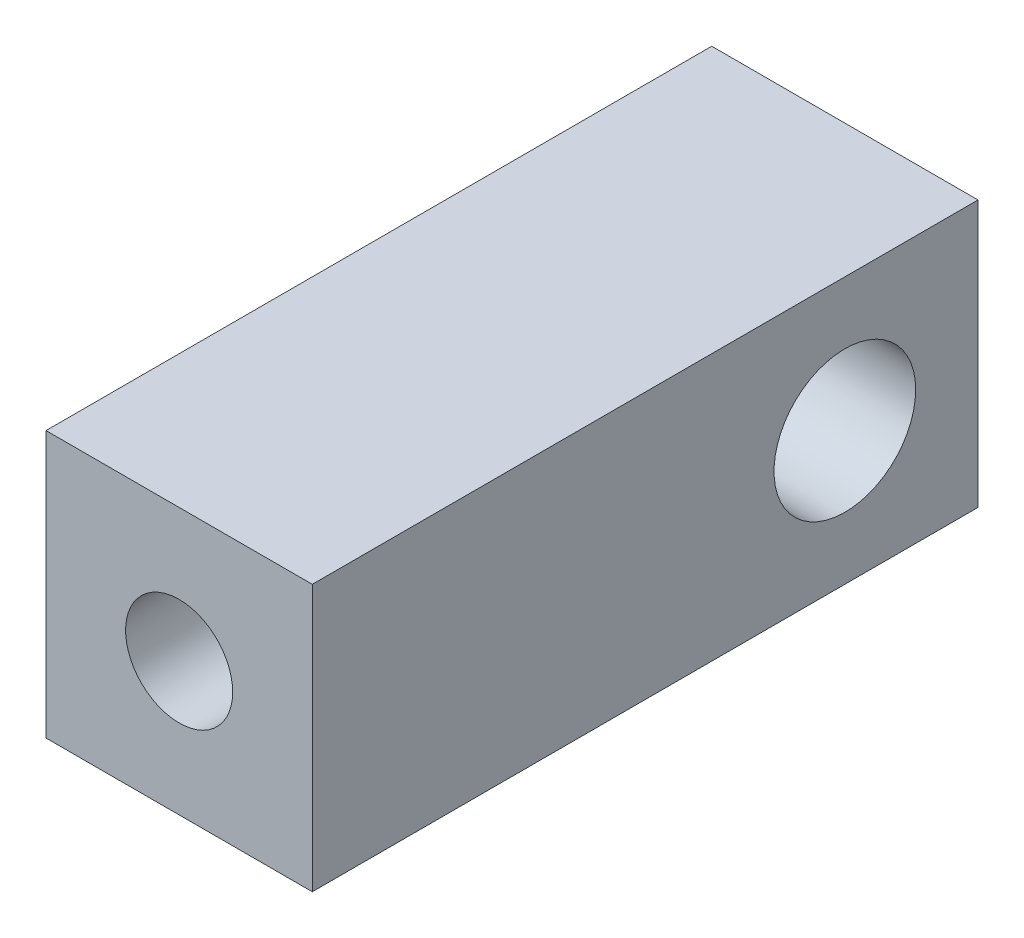
from build123d import *

# Parameters (mm, degrees)
SKETCH1_W                   = 31.75
SKETCH1_H                   = 12.7
BOSS_EXTRUDE1_DEPTH         = 12.7
F_1_4_20_TAPPED_HOLE1_D     = 5.1054
F_1_4_20_TAPPED_HOLE1_DEPTH = 16.51
F_1_4_20_TAPPED_HOLE1_TIP   = 1.533816902
SKETCH4_R                   = 3.3782
CUT_EXTRUDE1_DEPTH          = 37.477972806


with BuildPart() as part:
    # Sketch1 → Boss-Extrude1 (new body)
    with BuildSketch(Plane(origin=(0, 0, 0), x_dir=(0, 0, -1), z_dir=(1, 0, 0))):
        with Locations((15.875, 6.35)):
            Rectangle(SKETCH1_W, SKETCH1_H)
    extrude(amount=BOSS_EXTRUDE1_DEPTH)

    # 1/4-20 Tapped Hole1
    with Locations(Plane.XY):
        with Locations((6.35, 6.35)):
            Hole(F_1_4_20_TAPPED_HOLE1_D / 2, depth=F_1_4_20_TAPPED_HOLE1_DEPTH)
            with Locations((0, 0, -(F_1_4_20_TAPPED_HOLE1_DEPTH + F_1_4_20_TAPPED_HOLE1_TIP / 2))):  # 118° drill point
                Cone(0, F_1_4_20_TAPPED_HOLE1_D / 2, F_1_4_20_TAPPED_HOLE1_TIP, mode=Mode.SUBTRACT)

    # Sketch4 → Cut-Extrude1 (cut, through all)
    with BuildSketch(Plane(origin=(12.7, 0, 0), x_dir=(0, 0, -1), z_dir=(1, 0, 0))):
        with Locations((25.4, 6.35)):
            Circle(SKETCH4_R)
    extrude(amount=-CUT_EXTRUDE1_DEPTH, mode=Mode.SUBTRACT)


solid = part.part
